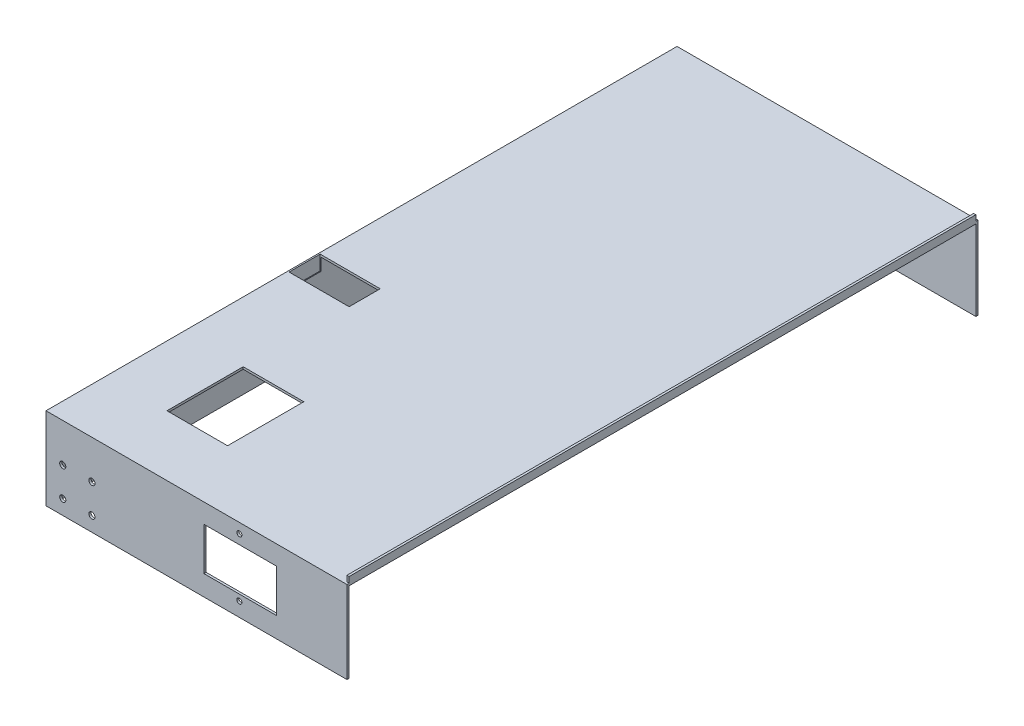
from build123d import *

# Parameters (mm, degrees)
SKETCH4_W            = 41.584358949
SKETCH4_H            = 52.301228267
BOSS_EXTRUDE4_DEPTH  = 1.5
SKETCH5_W            = 205
SKETCH5_H            = 56.5
BOSS_EXTRUDE5_DEPTH  = 1.5
SKETCH8_W            = 1.5
SKETCH8_H            = 430
BOSS_EXTRUDE14_DEPTH = 4
SKETCH7_W            = 205
SKETCH7_H            = 56.5
BOSS_EXTRUDE18_DEPTH = 1.5
SKETCH9_W            = 433
SKETCH9_H            = 56.5
BOSS_EXTRUDE19_DEPTH = 1.5
SKETCH15_R           = 2.1
CUT_EXTRUDE1_DEPTH   = 10
CUT_EXTRUDE2_START   = -10
SKETCH14_R           = 2.1
CUT_EXTRUDE2_DEPTH   = 10
CUT_EXTRUDE3_START   = -10
SKETCH12_R           = 2.1
CUT_EXTRUDE3_DEPTH   = 10
CUT_EXTRUDE4_START   = -10
SKETCH10_R           = 2.1
CUT_EXTRUDE4_DEPTH   = 10
CUT_EXTRUDE5_START   = -10
SKETCH11_R           = 2.1
CUT_EXTRUDE5_DEPTH   = 10
SKETCH17_W           = 41.213444594
SKETCH17_H           = 21.329304938
CUT_EXTRUDE6_DEPTH   = 10
SKETCH18_W           = 49.58132489
SKETCH18_H           = 29.319564564
CUT_EXTRUDE7_DEPTH   = 10
SKETCH19_R           = 1.75
CUT_EXTRUDE8_DEPTH   = 10


with BuildPart() as part:
    # Sketch4 → Boss-Extrude4 (new body)
    with BuildSketch(Plane(origin=(0, 0, 0), x_dir=(1, 0, 0), z_dir=(0, 1, 0))):
        Polygon((139.373653762, 430), (344.373653762, 430), (344.373653762, 0), (139.373653762, 0), (139.373653762, 65), (139.373653762, 230), align=None)
        with Locations((200.165833237, 66.150614133)):
            Rectangle(SKETCH4_W, SKETCH4_H, mode=Mode.SUBTRACT)
    extrude(amount=BOSS_EXTRUDE4_DEPTH)

    # Sketch5 → Boss-Extrude5 (add)
    with BuildSketch(Plane.XY):
        with Locations((241.873653762, -26.75)):
            Rectangle(SKETCH5_W, SKETCH5_H)
    extrude(amount=BOSS_EXTRUDE5_DEPTH)

    # Sketch8 → Boss-Extrude14 (add)
    with BuildSketch(Plane(origin=(0, 1.5, 0), x_dir=(1, 0, 0), z_dir=(0, 1, 0))):
        with Locations((343.623653762, 215)):
            Rectangle(SKETCH8_W, SKETCH8_H)
    extrude(amount=BOSS_EXTRUDE14_DEPTH)

    # Sketch7 → Boss-Extrude18 (add)
    with BuildSketch(Plane(origin=(0, 0, -430), x_dir=(-1, 0, 0), z_dir=(0, 0, -1))):
        with Locations((-241.873653762, -26.75)):
            Rectangle(SKETCH7_W, SKETCH7_H)
    extrude(amount=BOSS_EXTRUDE18_DEPTH)

    # Sketch9 → Boss-Extrude19 (add)
    with BuildSketch(Plane.ZY.offset(-139.373653762)):
        with Locations((-215, -26.75)):
            Rectangle(SKETCH9_W, SKETCH9_H)
    extrude(amount=BOSS_EXTRUDE19_DEPTH)

    # Sketch15 → Cut-Extrude1 (cut)
    with BuildSketch(Plane(origin=(0, 0, -431.5), x_dir=(-1, 0, 0), z_dir=(0, 0, -1))):
        with Locations((-169.373653762, -25)):
            Circle(SKETCH15_R)
        with Locations((-149.373653762, -25)):
            Circle(SKETCH15_R)
        with Locations((-169.373653762, -45)):
            Circle(SKETCH15_R)
        with Locations((-149.373653762, -45)):
            Circle(SKETCH15_R)
    extrude(amount=-CUT_EXTRUDE1_DEPTH, mode=Mode.SUBTRACT)

    # Sketch14 → Cut-Extrude2 (cut)
    with BuildSketch(Plane.XY.offset(1.5).offset(CUT_EXTRUDE2_START)):
        with Locations((169.373653762, -25)):
            Circle(SKETCH14_R)
    extrude(amount=CUT_EXTRUDE2_DEPTH, mode=Mode.SUBTRACT)

    # Sketch12 → Cut-Extrude3 (cut)
    with BuildSketch(Plane.XY.offset(1.5).offset(CUT_EXTRUDE3_START)):
        with Locations((149.373653762, -25)):
            Circle(SKETCH12_R)
    extrude(amount=CUT_EXTRUDE3_DEPTH, mode=Mode.SUBTRACT)

    # Sketch10 → Cut-Extrude4 (cut)
    with BuildSketch(Plane.XY.offset(1.5).offset(CUT_EXTRUDE4_START)):
        with Locations((169.373653762, -45)):
            Circle(SKETCH10_R)
    extrude(amount=CUT_EXTRUDE4_DEPTH, mode=Mode.SUBTRACT)

    # Sketch11 → Cut-Extrude5 (cut)
    with BuildSketch(Plane.XY.offset(1.5).offset(CUT_EXTRUDE5_START)):
        with Locations((149.373653762, -45)):
            Circle(SKETCH11_R)
    extrude(amount=CUT_EXTRUDE5_DEPTH, mode=Mode.SUBTRACT)

    # Sketch17 → Cut-Extrude6 (cut)
    with BuildSketch(Plane(origin=(0, 1.5, 0), x_dir=(1, 0, 0), z_dir=(0, 1, 0))):
        with Locations((159.4438263, 174.976392302)):
            Rectangle(SKETCH17_W, SKETCH17_H)
    extrude(amount=-CUT_EXTRUDE6_DEPTH, mode=Mode.SUBTRACT)

    # Sketch18 → Cut-Extrude7 (cut)
    with BuildSketch(Plane.XY.offset(1.5)):
        with Locations((271.095507036, -26.431235763)):
            Rectangle(SKETCH18_W, SKETCH18_H)
    extrude(amount=-CUT_EXTRUDE7_DEPTH, mode=Mode.SUBTRACT)

    # Sketch19 → Cut-Extrude8 (cut)
    with BuildSketch(Plane.XY.offset(1.5)):
        with Locations((270.543410902, -5.271453481)):
            Circle(SKETCH19_R)
        with Locations((270.543410902, -45.271453481)):
            Circle(SKETCH19_R)
    extrude(amount=-CUT_EXTRUDE8_DEPTH, mode=Mode.SUBTRACT)


solid = part.part
